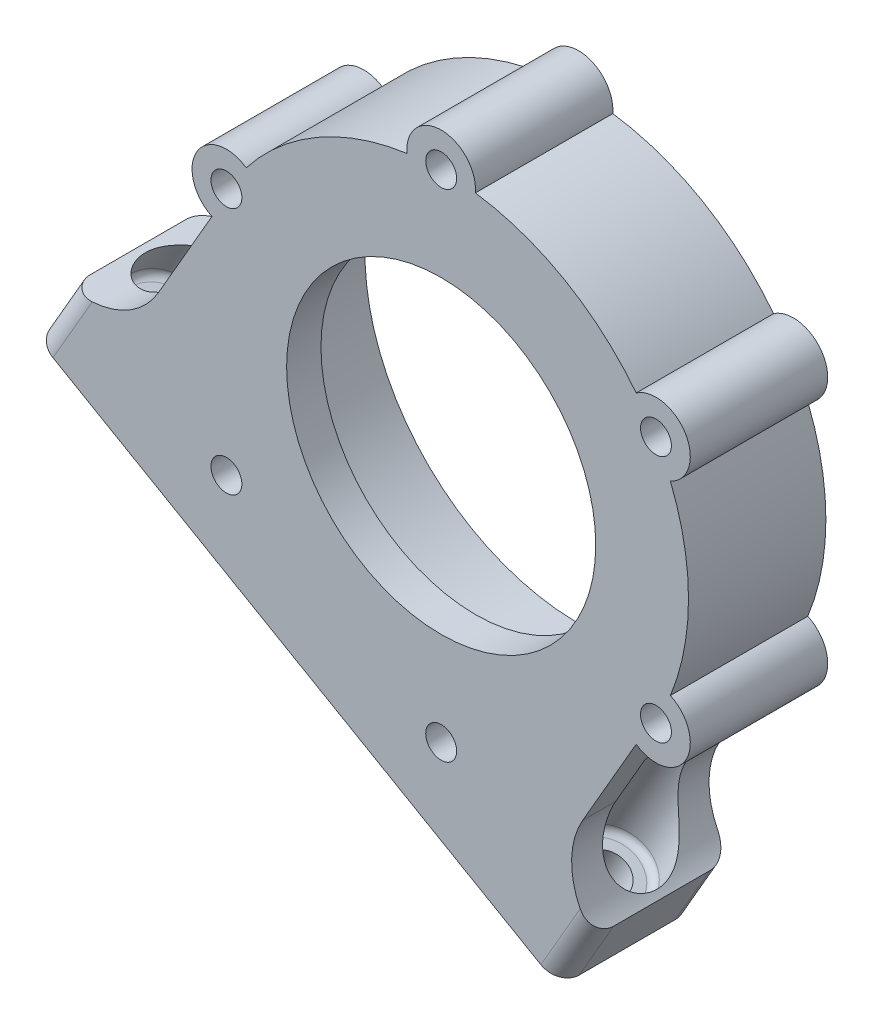
from build123d import *

# Parameters (mm, degrees)
SKETCH1_R           = 36
SKETCH1_R_2         = 31.1
BOSS_EXTRUDE1_DEPTH = 15
SKETCH2_R           = 36
BOSS_EXTRUDE2_DEPTH = 5
SKETCH3_R           = 22.5
CUT_EXTRUDE1_DEPTH  = 5
SKETCH4_R           = 5
BOSS_EXTRUDE3_DEPTH = 20
BOSS_EXTRUDE4_DEPTH = 20
SKETCH7_R           = 2.25
CUT_EXTRUDE2_DEPTH  = 78.645922206
SKETCH9_W           = 8.35
SKETCH9_H           = 20
BOSS_EXTRUDE5_DEPTH = 10
FILLET1_R           = 12
SKETCH10_R          = 3
CUT_EXTRUDE3_DEPTH  = 30
CUT_EXTRUDE5_START  = -5
SKETCH10_4_R        = 5.5
SKETCH10_4_R_2      = 3
CUT_EXTRUDE5_DEPTH  = 25
FILLET2_R           = 3
FILLET3_R           = 1


with BuildPart() as part:
    # Sketch1 → Boss-Extrude1 (new body)
    with BuildSketch(Plane.XY):
        Circle(SKETCH1_R)
        Circle(SKETCH1_R_2, mode=Mode.SUBTRACT)
    extrude(amount=BOSS_EXTRUDE1_DEPTH)

    # Sketch2 → Boss-Extrude2 (add)
    with BuildSketch(Plane.XY.offset(15)):
        Circle(SKETCH2_R)
    extrude(amount=BOSS_EXTRUDE2_DEPTH)

    # Sketch3 → Cut-Extrude1 (cut)
    with BuildSketch(Plane.XY.offset(20)):
        Circle(SKETCH3_R)
    extrude(amount=-CUT_EXTRUDE1_DEPTH, mode=Mode.SUBTRACT)

    # Sketch4 → Boss-Extrude3 (add)
    with BuildSketch(Plane(origin=(0, 0, 0), x_dir=(-1, 0, 0), z_dir=(0, 0, -1))):
        with Locations((0, 36.1)):
            Circle(SKETCH4_R)
        with Locations((31.263517077, 18.05)):
            Circle(SKETCH4_R)
        with Locations((31.263517077, -18.05)):
            Circle(SKETCH4_R)
        with Locations((0, -36.1)):
            Circle(SKETCH4_R)
        with Locations((-31.263517077, -18.05)):
            Circle(SKETCH4_R)
        with Locations((-31.263517077, 18.05)):
            Circle(SKETCH4_R)
    extrude(amount=-BOSS_EXTRUDE3_DEPTH)

    # Sketch8 → Boss-Extrude4 (add)
    with BuildSketch(Plane(origin=(0, 0, 0), x_dir=(-1, 0, 0), z_dir=(0, 0, -1))):
        with BuildLine():
            Line((-28.387135314, -22.139795588), (-9.877135314, -54.200056036))
            Line((-9.877135314, -54.200056036), (51.877193071, -18.54617792))
            Line((51.877193071, -18.54617792), (33.367193071, 13.514082528))
            ThreePointArc((33.367193071, 13.514082528), (18, -31.176914536), (-28.387135314, -22.139795588))
        make_face()
    extrude(amount=-BOSS_EXTRUDE4_DEPTH)

    # Sketch7 → Cut-Extrude2 (cut, through all)
    with BuildSketch(Plane(origin=(0, 0, 0), x_dir=(-1, 0, 0), z_dir=(0, 0, -1))):
        with Locations((-31.263517077, 18.05)):
            Circle(SKETCH7_R)
        with Locations((0, 36.1)):
            Circle(SKETCH7_R)
        with Locations((31.263517077, 18.05)):
            Circle(SKETCH7_R)
        with Locations((31.263517077, -18.05)):
            Circle(SKETCH7_R)
        with Locations((0, -36.1)):
            Circle(SKETCH7_R)
        with Locations((-31.263517077, -18.05)):
            Circle(SKETCH7_R)
    extrude(amount=-CUT_EXTRUDE2_DEPTH, mode=Mode.SUBTRACT)

    # Sketch9 → Boss-Extrude5 (add)
    with BuildSketch(Plane(origin=(-21.000028879, -36.373116978, 0), x_dir=(0.8660254037844385, -0.5000000000000004, 0), z_dir=(-0.5000000000000003, -0.8660254037844384, 0))):
        with Locations((-39.828878116, 10)):
            Rectangle(SKETCH9_W, SKETCH9_H)
        with Locations((39.828878116, 10)):
            Rectangle(SKETCH9_W, SKETCH9_H)
    extrude(amount=-BOSS_EXTRUDE5_DEPTH)

    # Fillet1
    # the kernel refuses this fillet: 12 mm, written as the material it adds along each edge
    with BuildSketch(Plane(origin=(-46.877193071, -9.885923882, 20), x_dir=(-0.8660254037844379, 0.500000000000001, 0), z_dir=(0, 0, -1))) as fillet1_piece_1:
        with BuildLine():
            CenterArc((12, 11.431425983), FILLET1_R, 180, 72.29196439)
            Line((0, 11.431425983), (-0.24, 11.431425983))
            Line((-0.24, 11.431425983), (-0.24, 0))
            Line((-0.24, 0), (0, -0.24))
            ThreePointArc((0, -0.24), (4.175, -0.24), (8.277, -0.22862852))
            Line((8.277, -0.22862852), (8.35, 0))
        make_face()
    extrude(amount=20)
    with BuildSketch(Plane(origin=(14.877135314, -45.539801998, 20), x_dir=(0.5000000000000003, 0.8660254037844385, 0), z_dir=(0, 0, -1))) as fillet1_piece_2:
        with BuildLine():
            CenterArc((11.431425983, 12), FILLET1_R, 197.70803561, 72.29196439)
            Line((0, 8.35), (-0.22862852, 8.277))
            ThreePointArc((-0.22862852, 8.277), (-0.24, 4.175), (-0.24, 0))
            Line((-0.24, 0), (0, -0.24))
            Line((0, -0.24), (11.431425983, -0.24))
            Line((11.431425983, -0.24), (11.431425983, 0))
        make_face()
    extrude(amount=20)

    # Sketch10 → Cut-Extrude3 (cut)
    with BuildSketch(Plane(origin=(-21.000028879, -36.373116978, 0), x_dir=(0.8660254037844385, -0.5000000000000004, 0), z_dir=(-0.5000000000000003, -0.8660254037844384, 0))):
        with Locations((37.503878116, 10)):
            Circle(SKETCH10_R)
        with Locations((-37.503878116, 10)):
            Circle(SKETCH10_R)
    extrude(amount=-CUT_EXTRUDE3_DEPTH, mode=Mode.SUBTRACT)

    # Sketch10<4> → Cut-Extrude5 (cut)
    # profile 1 of 2: a face of its own
    with BuildSketch(Plane(origin=(-21.000028879, -36.373116978, 0), x_dir=(0.8660254037844385, -0.5000000000000004, 0), z_dir=(-0.5000000000000003, -0.8660254037844384, 0)).offset(CUT_EXTRUDE5_START)):
        with Locations((37.503878116, 10)):
            Circle(SKETCH10_4_R)
        with Locations((37.503878116, 10)):
            Circle(SKETCH10_4_R_2, mode=Mode.SUBTRACT)
    # profile 2 of 2: a face of its own
    with BuildSketch(Plane(origin=(-21.000028879, -36.373116978, 0), x_dir=(0.8660254037844385, -0.5000000000000004, 0), z_dir=(-0.5000000000000003, -0.8660254037844384, 0)).offset(CUT_EXTRUDE5_START)):
        with Locations(Location((-37.503878116, 10, 0), (0, 0, 289.655481315))):
            Circle(SKETCH10_4_R)
        with Locations((-37.503878116, 10)):
            Circle(SKETCH10_4_R_2, mode=Mode.SUBTRACT)
    extrude(amount=-CUT_EXTRUDE5_DEPTH, mode=Mode.SUBTRACT)

    # Fillet2
    fillet2_edges = [part.edges().sort_by_distance(p)[0] for p in [
        (-56.608505192, -10.041050901, 0),
        (-56.608505192, -10.041050901, 20),
        (19.608447435, -54.044929017, 0),
        (19.608447435, -54.044929017, 20),
    ]]
    fillet(fillet2_edges, radius=FILLET2_R)

    # Fillet3
    fillet3_edges = [part.edges().sort_by_distance(p)[0] for p in [
        (-52.581487065, -12.366050901, 15.179527005),
        (9.21614259, -48.044929017, 10),
    ]]
    fillet(fillet3_edges, radius=FILLET3_R)


solid = part.part
